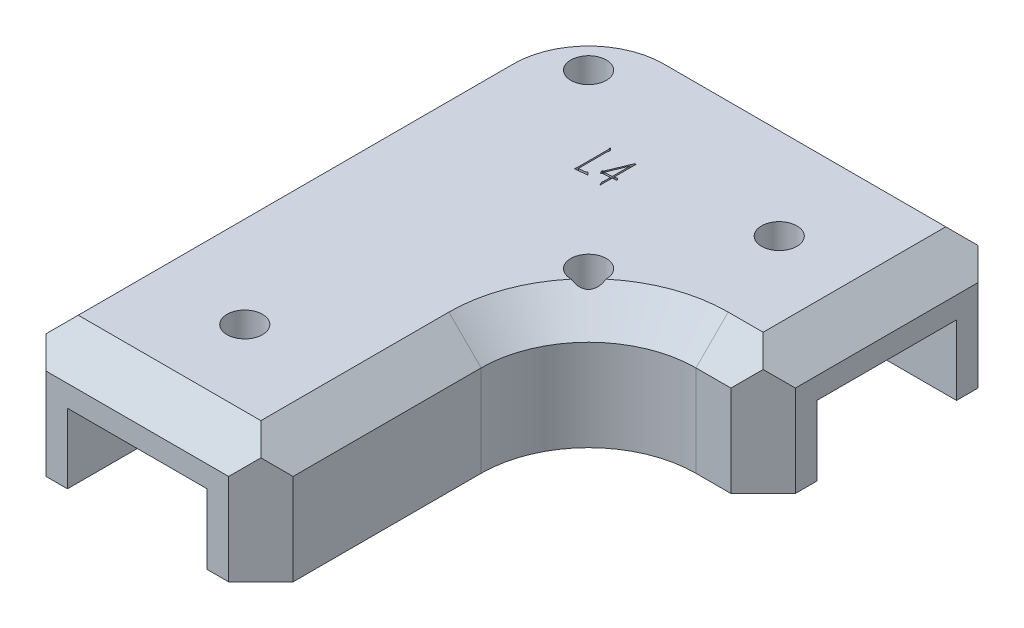
from build123d import *

# Parameters (mm, degrees)
SKETCH_1_W          = 23
SKETCH_1_H          = 23
SKETCH_1_W_2        = 13
SKETCH_1_H_2        = 13
EXTRUDE_1_DEPTH     = 53.5
SKETCH_2_R          = 1.65
CUT_EXTRUDE_1_DEPTH = 34
SKETCH_4_W          = 23
SKETCH_4_H          = 23
SKETCH_4_R          = 3
EXTRUDE_2_DEPTH     = 6.25
SKETCH_5_W          = 23
SKETCH_5_H          = 23
SKETCH_5_W_2        = 13
SKETCH_5_H_2        = 13
EXTRUDE_1_2_DEPTH   = 10
SKETCH_6_R          = 1.65
CUT_EXTRUDE_2_DEPTH = 39
SKETCH_7_W          = 13
SKETCH_7_H          = 13
CUT_EXTRUDE_3_DEPTH = 15.75
CHAMFER_1_SIZE      = 3
SKETCH_8_W          = 39.25
SKETCH_8_H          = 53.5
CUT_EXTRUDE_4_DEPTH = 11.5
EXTRUDE_3_DEPTH     = 6.5
FILLET_1_R          = 10
FILLET_2_R          = 10
SKETCH_10_R         = 1.65
CUT_EXTRUDE_5_DEPTH = 28.5
CHAMFER_3_SIZE      = 3
CHAMFER_4_SIZE      = 3
CHAMFER_5_SIZE      = 3
CUT_EXTRUDE_6_DEPTH = 0.3


with BuildPart() as part:
    # 草图1 → Extrude 1 (new body)
    with BuildSketch(Plane.XY):
        with Locations((6.5, 6.5)):
            Rectangle(SKETCH_1_W, SKETCH_1_H)
        with Locations((6.5, 6.5)):
            Rectangle(SKETCH_1_W_2, SKETCH_1_H_2, mode=Mode.SUBTRACT)
    extrude(amount=EXTRUDE_1_DEPTH)

    # 草图2 → 切除-拉伸1 (cut)
    with BuildSketch(Plane.XZ.offset(5)):
        with Locations(Location((6.5, 43.5, 0), (0, 0, 270))):
            Circle(SKETCH_2_R)
    extrude(amount=-CUT_EXTRUDE_1_DEPTH, mode=Mode.SUBTRACT)

    # 草图4 → 凸台-拉伸2 (add)
    with BuildSketch(Plane(origin=(18, 0, 0), x_dir=(0, 0, -1), z_dir=(1, 0, 0))):
        with Locations((-11.5, 6.5)):
            Rectangle(SKETCH_4_W, SKETCH_4_H)
        with Locations(Location((-11.5, 6.5, 0), (0, 0, 90))):
            Circle(SKETCH_4_R, mode=Mode.SUBTRACT)
    extrude(amount=EXTRUDE_2_DEPTH)

    # 草图5 → Extrude 1 2 (add)
    with BuildSketch(Plane(origin=(24.25, 0, 0), x_dir=(0, 0, -1), z_dir=(1, 0, 0))):
        with Locations((-11.5, 6.5)):
            Rectangle(SKETCH_5_W, SKETCH_5_H)
        with Locations((-11.5, 6.5)):
            Rectangle(SKETCH_5_W_2, SKETCH_5_H_2, mode=Mode.SUBTRACT)
    extrude(amount=EXTRUDE_1_2_DEPTH)

    # 草图6 → 切除-拉伸2 (cut)
    with BuildSketch(Plane(origin=(0, 18, 0), x_dir=(1, 0, 0), z_dir=(0, 1, 0))):
        with Locations(Location((24.25, -11.5, 0), (0, 0, 270))):
            Circle(SKETCH_6_R)
    extrude(amount=-CUT_EXTRUDE_2_DEPTH, mode=Mode.SUBTRACT)

    # 草图7 → 切除-拉伸3 (cut)
    with BuildSketch(Plane(origin=(24.25, 0, 0), x_dir=(0, 0, -1), z_dir=(1, 0, 0))):
        with Locations((-11.5, 6.5)):
            Rectangle(SKETCH_7_W, SKETCH_7_H)
    extrude(amount=-CUT_EXTRUDE_3_DEPTH, mode=Mode.SUBTRACT)

    # 倒角1
    chamfer_1_edges = [part.edges().sort_by_distance(p)[0] for p in [
        (13, 6.5, 18),
    ]]
    chamfer(chamfer_1_edges, length=CHAMFER_1_SIZE)

    # 草图8 → 切除-拉伸4 (cut)
    with BuildSketch(Plane.XZ.offset(5)):
        with Locations((14.625, 26.75)):
            Rectangle(SKETCH_8_W, SKETCH_8_H)
    extrude(amount=-CUT_EXTRUDE_4_DEPTH, mode=Mode.SUBTRACT)

    # 草图9 → 凸台-拉伸3 (add)
    with BuildSketch(Plane.XZ.offset(-13)):
        Polygon((13, 5), (0, 18), (0, 0), (13, 0), align=None)
    extrude(amount=EXTRUDE_3_DEPTH)

    # 圆角1
    fillet_1_edges = [part.edges().sort_by_distance(p)[0] for p in [
        (-5, 12.25, 0),
    ]]
    fillet(fillet_1_edges, radius=FILLET_1_R)

    # 圆角2
    fillet_2_edges = [part.edges().sort_by_distance(p)[0] for p in [
        (18, 12.25, 23),
    ]]
    fillet(fillet_2_edges, radius=FILLET_2_R)

    # 草图10 → 切除-拉伸5 (cut)
    with BuildSketch(Plane.XZ.offset(-6.5)):
        with Locations(Location((2, 7, 0), (0, 0, 270))):
            Circle(SKETCH_10_R)
        with Locations(Location((18, 23, 0), (0, 0, 270))):
            Circle(SKETCH_10_R)
    extrude(amount=-CUT_EXTRUDE_5_DEPTH, mode=Mode.SUBTRACT)

    # 倒角3
    # the kernel refuses this chamfer: 3 mm, written as the material it takes off along each edge
    with BuildSketch(Plane(origin=(5, 18, 10), x_dir=(0, 0, -1), z_dir=(1, 0, 0))) as chamfer_3_piece_1:
        Polygon((10 - CHAMFER_3_SIZE, 0), (10, -CHAMFER_3_SIZE), (10, 0), align=None)
    revolve(axis=Axis((5, 18, 10), (0, 1, 0)), revolution_arc=90, mode=Mode.SUBTRACT)
    with BuildSketch(Plane(origin=(28, 18, 33), x_dir=(-1, 0, 0), z_dir=(0, 0, 1))) as chamfer_3_piece_2:
        Polygon((10 + CHAMFER_3_SIZE, 0), (10, CHAMFER_3_SIZE), (10, 0), align=None)
    revolve(axis=Axis((28, 18, 33), (0, -1, 0)), revolution_arc=90, mode=Mode.SUBTRACT)
    with BuildSketch(Plane(origin=(28, 18, 23), x_dir=(0, 0.027495876610586768, -0.9996219169112968), z_dir=(1, 0, 0))) as chamfer_3_piece_3:
        Polygon((CHAMFER_3_SIZE * 0.999621916911, -CHAMFER_3_SIZE * 0.0274958766106), (-CHAMFER_3_SIZE * 0.0274958766106, -CHAMFER_3_SIZE * 0.999621916911), (0, 0), align=None)
    extrude(amount=13.965048964, mode=Mode.SUBTRACT)
    with BuildSketch(Plane(origin=(41.965048964, 18, 0), x_dir=(0, 0.027495876610586778, 0.9996219169112968), z_dir=(-1, 0, 0))) as chamfer_3_piece_4:
        Polygon((CHAMFER_3_SIZE * 0.999621916911, -CHAMFER_3_SIZE * 0.0274958766106), (-CHAMFER_3_SIZE * 0.0274958766106, -CHAMFER_3_SIZE * 0.999621916911), (0, 0), align=None)
    extrude(amount=36.965048964, mode=Mode.SUBTRACT)
    with BuildSketch(Plane(origin=(-5, 18, 10), x_dir=(0.9996219169112968, 0.027495876610586778, 0), z_dir=(0, 0, 1))) as chamfer_3_piece_5:
        Polygon((CHAMFER_3_SIZE * 0.999621916911, -CHAMFER_3_SIZE * 0.0274958766106), (-CHAMFER_3_SIZE * 0.0274958766106, -CHAMFER_3_SIZE * 0.999621916911), (0, 0), align=None)
    extrude(amount=51.215048964, mode=Mode.SUBTRACT)
    with BuildSketch(Plane(origin=(18, 18, 33), x_dir=(-0.9996219169112968, 0.02749587661058678, 0), z_dir=(0, 0, 1))) as chamfer_3_piece_6:
        Polygon((CHAMFER_3_SIZE * 0.999621916911, CHAMFER_3_SIZE * 0.0274958766106), (-CHAMFER_3_SIZE * 0.0274958766106, CHAMFER_3_SIZE * 0.999621916911), (0, 0), align=None)
    extrude(amount=28.215048964, mode=Mode.SUBTRACT)

    # 倒角4
    chamfer_4_edges = [part.edges().sort_by_distance(p)[0] for p in [
        (34.25, 18, 11.5),
        (6.5, 18, 53.5),
    ]]
    chamfer(chamfer_4_edges, length=CHAMFER_4_SIZE)

    # 倒角5
    chamfer_5_edges = [part.edges().sort_by_distance(p)[0] for p in [
        (34.25, 10.75, 0),
        (18, 10.75, 53.5),
        (-5, 10.75, 53.5),
        (34.25, 10.75, 23),
    ]]
    chamfer(chamfer_5_edges, length=CHAMFER_5_SIZE)

    # 草图11 → 切除-拉伸6 (cut)
    # profile 1 of 2: a face of its own
    with BuildSketch(Plane(origin=(0, 18, 0), x_dir=(1, 0, 0), z_dir=(0, 1, 0))):
        with BuildLine():
            Line((9.266813218, -12.275683704), (9.301865424, -12.235410958))
            Line((9.301865424, -12.235410958), (9.52336553, -12.512099643))
            add(Edge.make_bspline(
                [(9.52336553, -12.512099643), (9.516963751, -12.524061704), (9.504318984, -12.547689117), (9.483420652, -12.58408966), (9.467037494, -12.629648361), (9.4564399, -12.686951648), (9.44894746, -12.755283372), (9.448352464, -12.804177447), (9.448040578, -12.829806867)],
                knots=[0, 0, 0, 0, 0.736410598, 1.454555069, 2.274010016, 3.348139226, 4.609940921, 6, 6, 6, 6], degree=3))
            Line((9.448040578, -12.829806867), (9.448040578, -15.396821569))
            add(Edge.make_bspline(
                [(9.448040578, -15.396821569), (9.468678125, -15.397042087), (9.506479393, -15.397446004), (9.557158846, -15.395009259), (9.596750153, -15.395226891), (9.629094922, -15.392529476), (9.663579716, -15.387912913), (9.708300118, -15.381986855), (9.768057065, -15.374741756), (9.837632832, -15.364777769), (9.908227888, -15.354286785), (9.969922175, -15.344844322), (10.017878618, -15.336418923), (10.062989469, -15.328613359), (10.107288304, -15.313240575), (10.146161972, -15.284882643), (10.171155498, -15.256112424), (10.190610238, -15.248788426), (10.197561141, -15.246171665)],
                knots=[0, 0, 0, 0, 1.271684107, 2.329311289, 3.126176351, 3.710204741, 4.32783396, 5.270448411, 6.49050515, 8.03759688, 9.602040843, 10.889228832, 11.884182716, 12.602334394, 13.712376462, 14.732953672, 15.547302315, 16, 16, 16, 16], degree=3))
            add(Edge.make_bspline(
                [(10.197561141, -15.246171665), (10.200811265, -15.24863479), (10.210252218, -15.255789669), (10.229119367, -15.272044232), (10.26040013, -15.297821919), (10.298329787, -15.334573391), (10.337260708, -15.37059091), (10.368228435, -15.399211988), (10.390470603, -15.419627911), (10.399083222, -15.440767903), (10.402676117, -15.45784931), (10.403710075, -15.467910384), (10.404145415, -15.472146521)],
                knots=[0, 0, 0, 0, 0.390394386, 1.134016561, 2.38360509, 4.269889804, 6.18981564, 7.453157385, 8.329021544, 9.032311711, 9.592562279, 10, 10, 10, 10], degree=3))
            add(Edge.make_bspline(
                [(10.404145415, -15.472146521), (10.40206375, -15.476942394), (10.397878443, -15.486584772), (10.383090877, -15.495937469), (10.363982572, -15.500904408), (10.33073977, -15.500343625), (10.283110462, -15.498769522), (10.22132921, -15.508356201), (10.15501695, -15.517554008), (10.102379022, -15.525784834), (10.062387506, -15.531592767), (10.033223518, -15.534164422), (9.996494325, -15.53828724), (9.951932173, -15.541590229), (9.899741162, -15.546219376), (9.839824995, -15.551393941), (9.772242849, -15.557543502), (9.724485896, -15.561206741), (9.699372349, -15.563133097)],
                knots=[0, 0, 0, 0, 0.341365878, 0.68633572, 1.116730632, 1.647491765, 2.890856209, 4.29325764, 5.800779701, 7.359923239, 7.845242571, 8.495183841, 9.311733456, 10.309872826, 11.474601469, 12.805924266, 14.320358265, 16, 16, 16, 16], degree=3))
            Line((9.699372349, -15.563133097), (9.488313325, -15.58326947))
            Line((9.488313325, -15.58326947), (9.371969835, -15.592964761))
            add(Edge.make_bspline(
                [(9.371969835, -15.592964761), (9.359859022, -15.596910851), (9.340230241, -15.603306534), (9.311283529, -15.599186231), (9.298718203, -15.582428084), (9.288983167, -15.564046832), (9.289718075, -15.535389642), (9.295112786, -15.4956315), (9.302089302, -15.440906027), (9.305306038, -15.399562146), (9.307085965, -15.376685196)],
                knots=[0, 0, 0, 0, 1.058270145, 1.715207142, 2.242218181, 2.723015089, 3.427046488, 4.550153686, 6.091084828, 8, 8, 8, 8], degree=3))
            Line((9.307085965, -15.376685196), (9.316781256, -15.079860137))
            Line((9.316781256, -15.079860137), (9.316781256, -12.814145243))
            add(Edge.make_bspline(
                [(9.316781256, -12.814145243), (9.316886855, -12.786052717), (9.317076564, -12.735584232), (9.315973066, -12.66871921), (9.315772104, -12.618974802), (9.313508673, -12.574485109), (9.310800273, -12.527231104), (9.306709072, -12.46863647), (9.297355447, -12.400354092), (9.283895077, -12.352602109), (9.276508509, -12.326397533)],
                knots=[0, 0, 0, 0, 1.372323329, 2.465391677, 3.267017655, 3.801925377, 4.641299591, 5.579257235, 6.671583216, 8, 8, 8, 8], degree=3))
            Line((9.276508509, -12.326397533), (9.266813218, -12.275683704))
        make_face()
    # profile 2 of 2: a face of its own
    with BuildSketch(Plane(origin=(0, 18, 0), x_dir=(1, 0, 0), z_dir=(0, 1, 0))):
        with BuildLine():
            Line((11.662295852, -14.631639383), (10.952302245, -14.67191213))
            Line((10.952302245, -14.67191213), (10.902334207, -14.747237082))
            add(Edge.make_bspline(
                [(10.902334207, -14.747237082), (10.89907351, -14.755130581), (10.894145585, -14.767060104), (10.875925797, -14.779362904), (10.862257335, -14.761715586), (10.855798411, -14.750206879), (10.851620378, -14.742762332)],
                knots=[0, 0, 0, 0, 1.282902353, 1.938863145, 2.666728425, 4, 4, 4, 4], degree=3))
            Line((10.851620378, -14.742762332), (10.756159053, -14.55109389))
            add(Edge.make_bspline(
                [(10.756159053, -14.55109389), (10.752075263, -14.539775538), (10.745341137, -14.521111693), (10.740438443, -14.496060274), (10.741832408, -14.478391928), (10.74506786, -14.4692654), (10.746463762, -14.465327855)],
                knots=[0, 0, 0, 0, 1.63130738, 2.690008936, 3.434818089, 4, 4, 4, 4], degree=3))
            Line((10.746463762, -14.465327855), (10.786736508, -14.455632564))
            Line((10.786736508, -14.455632564), (10.841925087, -14.425055109))
            Line((10.841925087, -14.425055109), (11.692873308, -12.37114503))
            Line((11.692873308, -12.37114503), (11.803250465, -12.37114503))
            Line((11.803250465, -12.37114503), (11.803250465, -14.445191482))
            add(Edge.make_bspline(
                [(11.803250465, -14.445191482), (11.813622011, -14.445270114), (11.831257584, -14.445403819), (11.847340005, -14.43838657), (11.853964295, -14.435496191)],
                knots=[0, 0, 0, 0, 1.176207474, 2, 2, 2, 2], degree=3))
            Line((11.853964295, -14.435496191), (11.929289247, -14.404918735))
            add(Edge.make_bspline(
                [(11.929289247, -14.404918735), (11.939026891, -14.401284394), (11.956383934, -14.394806297), (11.978733372, -14.385077379), (11.994554633, -14.377586554), (12.001926587, -14.371929086), (12.004614199, -14.36986653)],
                knots=[0, 0, 0, 0, 1.495147538, 2.665053038, 3.513315187, 4, 4, 4, 4], degree=3))
            Line((12.004614199, -14.36986653), (12.039666404, -14.340034866))
            Line((12.039666404, -14.340034866), (12.180621017, -14.485464229))
            add(Edge.make_bspline(
                [(12.180621017, -14.485464229), (12.187801764, -14.494105754), (12.199556354, -14.508251578), (12.204686736, -14.532190552), (12.199794163, -14.548379765), (12.19064813, -14.560038294), (12.174705658, -14.564925245), (12.162970778, -14.565605945), (12.156009894, -14.566009722)],
                knots=[0, 0, 0, 0, 1.690587597, 2.767423091, 3.557953073, 4.202677464, 4.933866242, 6, 6, 6, 6], degree=3))
            Line((12.156009894, -14.566009722), (11.803250465, -14.606282468))
            Line((11.803250465, -14.606282468), (11.803250465, -15.507944518))
            add(Edge.make_bspline(
                [(11.803250465, -15.507944518), (11.803232512, -15.510679439), (11.803172094, -15.519883497), (11.80433053, -15.539259214), (11.80480027, -15.570089271), (11.805404744, -15.608399492), (11.806439968, -15.6468409), (11.8061055, -15.67797641), (11.804087339, -15.697610778), (11.799340663, -15.710229116), (11.790049194, -15.712488517), (11.785280059, -15.71030151), (11.783114092, -15.709308252)],
                knots=[0, 0, 0, 0, 0.375701713, 1.264380521, 2.665139726, 4.612257271, 6.525225464, 7.960129458, 8.858599367, 9.286556546, 9.675980055, 10, 10, 10, 10], degree=3))
            add(Edge.make_bspline(
                [(11.783114092, -15.709308252), (11.778903236, -15.706805374), (11.766209459, -15.699260359), (11.755084299, -15.674911777), (11.741716695, -15.649639385), (11.735707323, -15.631341151), (11.733146055, -15.623542217)],
                knots=[0, 0, 0, 0, 0.572299195, 1.725216547, 3.030459198, 4, 4, 4, 4], degree=3))
            Line((11.733146055, -15.623542217), (11.687652767, -15.532555641))
            Line((11.687652767, -15.532555641), (11.662295852, -15.46245123))
            add(Edge.make_bspline(
                [(11.662295852, -15.46245123), (11.658439784, -15.454050251), (11.651462153, -15.438848513), (11.643818588, -15.417893938), (11.636994063, -15.402423867), (11.633195029, -15.384019199), (11.63765141, -15.355267833), (11.647473016, -15.315004179), (11.659268246, -15.271961287), (11.664810088, -15.232629705), (11.66708518, -15.198722696), (11.667370597, -15.176816345), (11.667516393, -15.165626172)],
                knots=[0, 0, 0, 0, 0.908031708, 1.643101311, 2.192199313, 2.565975908, 3.473020803, 5.002279505, 6.661670863, 7.846934984, 8.900174221, 10, 10, 10, 10], degree=3))
            Line((11.667516393, -15.165626172), (11.662295852, -14.631639383))
        make_face()
        Polygon((11.667516393, -14.465327855), (11.667516393, -12.79400887), (10.957522786, -14.501125852), align=None, mode=Mode.SUBTRACT)
    extrude(amount=-CUT_EXTRUDE_6_DEPTH, mode=Mode.SUBTRACT)


solid = part.part
